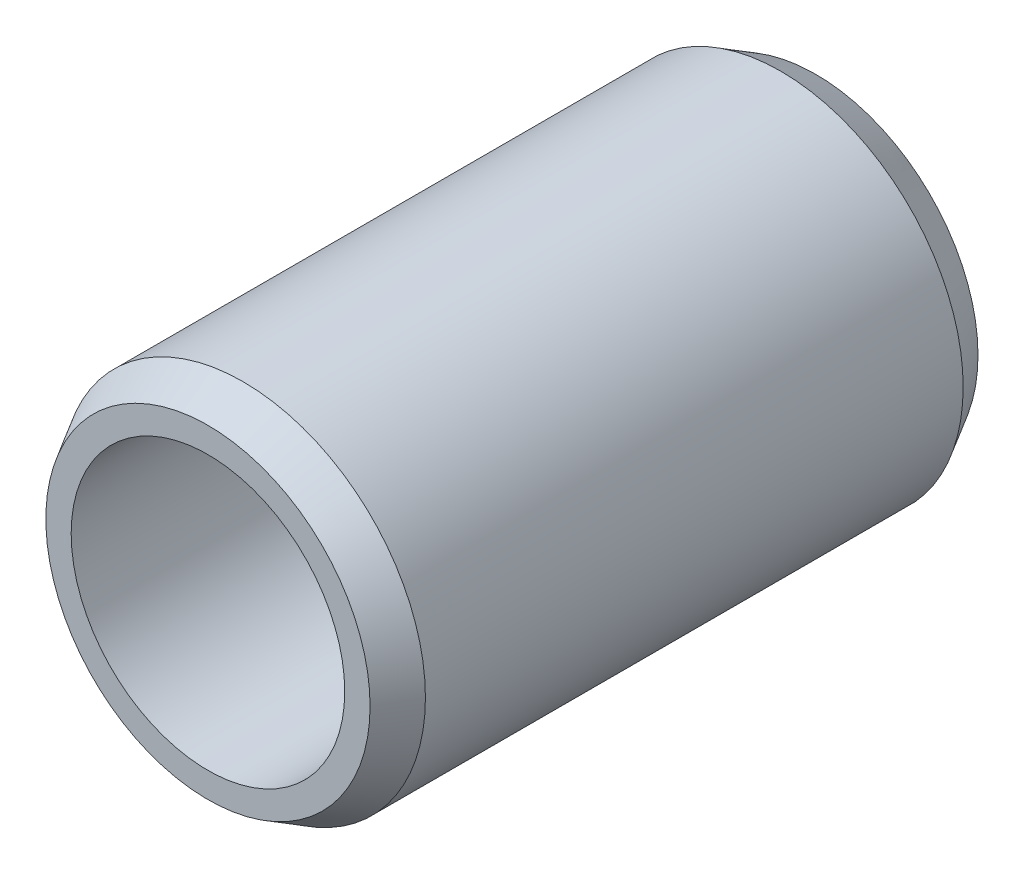
from build123d import *
from OCP.BRepFilletAPI import BRepFilletAPI_MakeChamfer

# Parameters (mm, degrees)
SKETCH1_R           = 4.5
SKETCH1_R_2         = 3.375
BOSS_EXTRUDE1_DEPTH = 15
CHAMFER1_SIZE       = 0.5
CHAMFER1_SIZE2      = 0.866025404


with BuildPart() as part:
    # Sketch1 → Boss-Extrude1 (new body)
    with BuildSketch(Plane.XY):
        Circle(SKETCH1_R)
        Circle(SKETCH1_R_2, mode=Mode.SUBTRACT)
    extrude(amount=BOSS_EXTRUDE1_DEPTH)

    # Chamfer1: one chamfer whose edges measure the first distance from different faces: ONE call of the kernel's chamfer builder (chamfer() names one face for all edges)
    chamfer1_edges_1 = [part.edges().sort_by_distance(p)[0] for p in [
        (-4.5, 0, 15),
    ]]
    chamfer1_side_1 = [part.faces().sort_by_distance(p)[0] for p in [
        (-4.372720779, 0, 15),
    ]]
    chamfer1_edges_2 = [part.edges().sort_by_distance(p)[0] for p in [
        (-4.5, 0, 0),
    ]]
    chamfer1_side_2 = [part.faces().sort_by_distance(p)[0] for p in [
        (-4.372720779, 0, 0),
    ]]
    chamfer1 = BRepFilletAPI_MakeChamfer(part.part.solid().wrapped)
    for e in chamfer1_edges_1:
        chamfer1.Add(CHAMFER1_SIZE, CHAMFER1_SIZE2, e.wrapped, chamfer1_side_1[0].wrapped)  # the first distance lies on this face
    for e in chamfer1_edges_2:
        chamfer1.Add(CHAMFER1_SIZE, CHAMFER1_SIZE2, e.wrapped, chamfer1_side_2[0].wrapped)  # the first distance lies on this face
    add(Compound.cast(chamfer1.Shape()), mode=Mode.REPLACE)


solid = part.part
